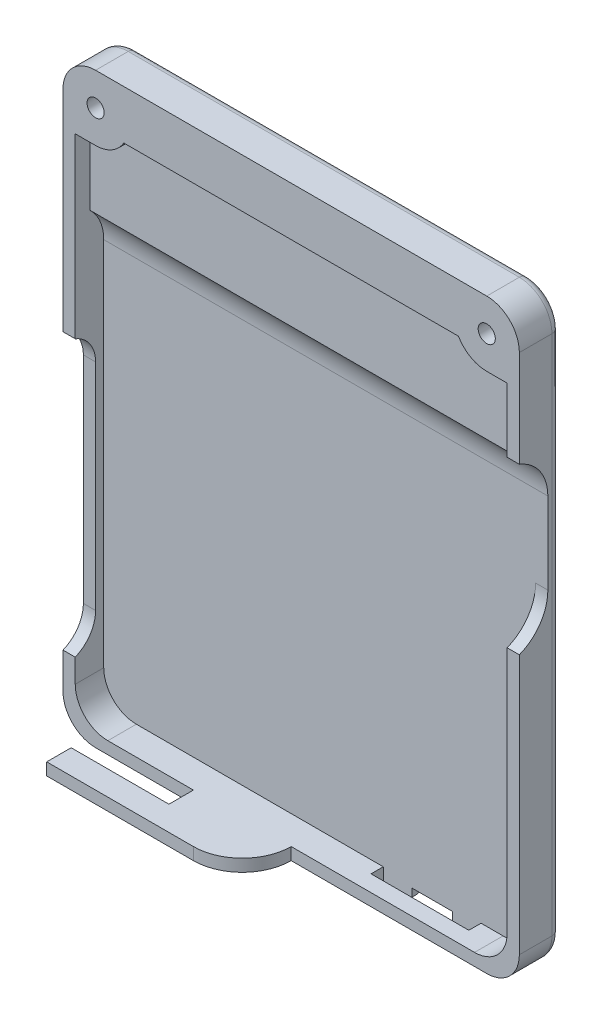
from build123d import *

# Parameters (mm, degrees)
SKETCH_1_W               = 56
SKETCH_1_H               = 72
EXTRUDE_1_DEPTH          = 5
SHELL_1_T                = -1.5
EXTRUDE_2_DEPTH          = 5
EXTRUDE_4_REACH          = 93.351
SKETCH_11_W              = 3.2
SKETCH_11_H              = 28
CUT_EXTRUDE_1_REACH      = 93.351
SKETCH_2_7_R             = 1.05
SKETCH_2_8_R             = 1.7
CUT_EXTRUDE_2_DEPTH      = 2.5
EXTRUDE_3_DEPTH          = 1.5
CUT_EXTRUDE_3_REACH      = 93.875
SKETCH_10_3_W            = 12
SKETCH_10_3_H            = 1.5
CUT_EXTRUDE_4_DEPTH      = 92.874914966
CUT_EXTRUDE_4_DEPTH_BACK = 1
SKETCH_10_4_W            = 5
SKETCH_10_4_H            = 1
CUT_EXTRUDE_5_REACH      = 93.875
CUT_EXTRUDE_START        = -54.5
CUT_EXTRUDE_6_DEPTH      = 54.5
FILLET_1_R               = 4
FILLET_2_R               = 4
FILLET_3_R               = 1


with BuildPart() as part:
    # 草图1 → 凸台-拉伸1 (new body)
    with BuildSketch(Plane.XY):
        with Locations((-28, 36)):
            Rectangle(SKETCH_1_W, SKETCH_1_H)
    extrude(amount=EXTRUDE_1_DEPTH)

    # 抽壳1
    shell_1_openings = [part.faces().sort_by_distance(p)[0] for p in [
        (-28, 36, 5),
    ]]
    offset(amount=SHELL_1_T, openings=shell_1_openings, kind=Kind.INTERSECTION)

    # 草图2 → 凸台-拉伸2 (add)
    with BuildSketch(Plane.XY):
        with BuildLine():
            Line((0, 72), (0, 68))
            ThreePointArc((0, 68), (-0.394448725, 66.267949192), (-1.5, 64.877501001))
            Line((-1.5, 64.877501001), (-1.5, 64))
            Line((-1.5, 64), (-4, 64))
            ThreePointArc((-4, 64), (-6, 64.535898385), (-7.464101615, 66))
            Line((-7.464101615, 66), (-48.535898385, 66))
            ThreePointArc((-48.535898385, 66), (-50, 64.535898385), (-52, 64))
            Line((-52, 64), (-54.5, 64))
            Line((-54.5, 64), (-54.5, 64.877501001))
            ThreePointArc((-54.5, 64.877501001), (-55.605551275, 66.267949192), (-56, 68))
            Line((-56, 68), (-56, 72))
            Line((-56, 72), (0, 72))
        make_face()
    extrude(amount=EXTRUDE_2_DEPTH)

    # 草图11 → 凸台-拉伸4 (add, up to next)
    with BuildSketch(Plane(origin=(0, 0, 0), x_dir=(0, 0, -1), z_dir=(1, 0, 0)), mode=Mode.PRIVATE) as extrude_4_sk1:
        with Locations((-1.6, 58)):
            Rectangle(SKETCH_11_W, SKETCH_11_H)
    extrude_4_tool1 = extrude(extrude_4_sk1.sketch, amount=-EXTRUDE_4_REACH, mode=Mode.PRIVATE) - part.part
    add(extrude_4_tool1.solids().sort_by_distance((0, 58, 1.6))[0])

    # 草图2<7> → 切除-拉伸1 (cut, up to next)
    with BuildSketch(Plane.XY, mode=Mode.PRIVATE) as cut_extrude_1_sk1:
        with Locations((-52, 68)):
            Circle(SKETCH_2_7_R)
    cut_extrude_1_tool1 = extrude(cut_extrude_1_sk1.sketch, amount=CUT_EXTRUDE_1_REACH, mode=Mode.PRIVATE) & part.part
    # 草图2<7> → 切除-拉伸1 (cut, up to next)
    with BuildSketch(Plane.XY, mode=Mode.PRIVATE) as cut_extrude_1_sk2:
        with Locations(Location((-4, 68, 0), (0, 0, 180))):
            Circle(SKETCH_2_7_R)
    cut_extrude_1_tool2 = extrude(cut_extrude_1_sk2.sketch, amount=CUT_EXTRUDE_1_REACH, mode=Mode.PRIVATE) & part.part
    add(cut_extrude_1_tool1.solids().sort_by_distance((-52, 68, 0))[0], mode=Mode.SUBTRACT)
    add(cut_extrude_1_tool2.solids().sort_by_distance((-4, 68, 0))[0], mode=Mode.SUBTRACT)

    # 草图2<8> → 切除-拉伸2 (cut)
    with BuildSketch(Plane.XY):
        with Locations((-52, 68)):
            Circle(SKETCH_2_8_R)
        with Locations(Location((-4, 68, 0), (0, 0, 180))):
            Circle(SKETCH_2_8_R)
    extrude(amount=CUT_EXTRUDE_2_DEPTH, mode=Mode.SUBTRACT)

    # 草图10 → 凸台-拉伸3 (add)
    with BuildSketch(Plane.XZ):
        with BuildLine():
            Line((-40, 5), (-40, 8))
            Line((-40, 8), (-52, 8))
            Line((-52, 8), (-52, 11))
            Line((-52, 11), (-34, 11))
            ThreePointArc((-34, 11), (-29.757359313, 9.242640687), (-28, 5))
            Line((-28, 5), (-40, 5))
        make_face()
    extrude(amount=-EXTRUDE_3_DEPTH)

    # 草图10<3> → 切除-拉伸3 (cut, up to next)
    with BuildSketch(Plane.XZ, mode=Mode.PRIVATE) as cut_extrude_3_sk1:
        with Locations((-14.2, 2.25)):
            Rectangle(SKETCH_10_3_W, SKETCH_10_3_H)
    cut_extrude_3_tool1 = extrude(cut_extrude_3_sk1.sketch, amount=-CUT_EXTRUDE_3_REACH, mode=Mode.PRIVATE) & part.part
    add(cut_extrude_3_tool1.solids().sort_by_distance((-14.2, 0, 2.25))[0], mode=Mode.SUBTRACT)

    # 草图10<4> → 切除-拉伸4 (cut, two sides: drawn at the far end of the back side and taken through both)
    with BuildSketch(Plane.XZ.offset(-CUT_EXTRUDE_4_DEPTH_BACK)):
        with Locations((-14.2, 1)):
            Rectangle(SKETCH_10_4_W, SKETCH_10_4_H)
    extrude(amount=CUT_EXTRUDE_4_DEPTH + CUT_EXTRUDE_4_DEPTH_BACK, mode=Mode.SUBTRACT)

    # 草图8 → 切除-拉伸5 (cut, up to next)
    with BuildSketch(Plane.ZY.offset(56), mode=Mode.PRIVATE) as cut_extrude_5_sk1:
        with BuildLine():
            Line((2.5, 38.500900756), (2.5, 12.087099244))
            ThreePointArc((2.5, 12.087099244), (3.18337521, 9.851031266), (5, 8.379))
            Line((5, 8.379), (5, 42.209))
            ThreePointArc((5, 42.209), (3.18337521, 40.736968734), (2.5, 38.500900756))
        make_face()
    cut_extrude_5_tool1 = extrude(cut_extrude_5_sk1.sketch, amount=-CUT_EXTRUDE_5_REACH, mode=Mode.PRIVATE) & part.part
    add(cut_extrude_5_tool1.solids().sort_by_distance((-56, 25.294, 3.786685))[0], mode=Mode.SUBTRACT)

    # 草图9 → 切除-拉伸6 (cut)
    with BuildSketch(Plane(origin=(0, 0, 0), x_dir=(0, 0, -1), z_dir=(1, 0, 0)).offset(CUT_EXTRUDE_START)):
        with BuildLine():
            Line((-1.5, 41), (-1.5, 51))
            ThreePointArc((-1.5, 51), (-7, 56.5), (-12.5, 51))
            Line((-12.5, 51), (-12.5, 41))
            ThreePointArc((-12.5, 41), (-7, 35.5), (-1.5, 41))
        make_face()
    extrude(amount=CUT_EXTRUDE_6_DEPTH, mode=Mode.SUBTRACT)

    # 圆角1
    fillet_1_edges = [part.edges().sort_by_distance(p)[0] for p in [
        (0, 0, 2.5),
        (-56, 0, 2.5),
        (-56, 72, 2.5),
        (0, 72, 2.5),
    ]]
    fillet(fillet_1_edges, radius=FILLET_1_R)

    # 圆角2
    fillet_2_edges = [part.edges().sort_by_distance(p)[0] for p in [
        (-1.5, 1.5, 3.25),
        (-54.5, 1.5, 3.25),
    ]]
    fillet(fillet_2_edges, radius=FILLET_2_R)

    # 圆角3
    # the kernel refuses this fillet: 1 mm, written as the material it takes off along each edge
    with BuildSketch(Plane(origin=(-52, 68, 0), x_dir=(1, 0, 0), z_dir=(0, -1, 0))) as fillet_3_piece_1:
        with BuildLine():
            CenterArc((1.7 + FILLET_3_R, FILLET_3_R), FILLET_3_R, 180, 90)
            Line((1.7, FILLET_3_R), (1.7, 0))
            Line((1.7, 0), (1.7 + FILLET_3_R, 0))
        make_face()
    revolve(axis=Axis((-52, 68, 0), (0, 0, 1)), mode=Mode.SUBTRACT)
    with BuildSketch(Plane(origin=(-4, 68, 0), x_dir=(-1, 0, 0), z_dir=(0, 1, 0))) as fillet_3_piece_2:
        with BuildLine():
            CenterArc((1.7 + FILLET_3_R, FILLET_3_R), FILLET_3_R, 180, 90)
            Line((1.7, FILLET_3_R), (1.7, 0))
            Line((1.7, 0), (1.7 + FILLET_3_R, 0))
        make_face()
    revolve(axis=Axis((-4, 68, 0), (0, 0, 1)), mode=Mode.SUBTRACT)
    with BuildSketch(Plane(origin=(-4, 4, 0), x_dir=(0, -1, 0), z_dir=(-1, 0, 0))) as fillet_3_piece_3:
        with BuildLine():
            CenterArc((4 - FILLET_3_R, FILLET_3_R), FILLET_3_R, 270, 90)
            Line((4 - FILLET_3_R, 0), (4, 0))
            Line((4, 0), (4, FILLET_3_R))
        make_face()
    revolve(axis=Axis((-4, 4, 0), (0, 0, 1)), revolution_arc=90, mode=Mode.SUBTRACT)
    with BuildSketch(Plane(origin=(0, 4, 0), x_dir=(0, 0, 1), z_dir=(0, 1, 0))) as fillet_3_piece_4:
        with BuildLine():
            CenterArc((FILLET_3_R, -FILLET_3_R), FILLET_3_R, 90, 90)
            Line((0, -FILLET_3_R), (0, 0))
            Line((0, 0), (FILLET_3_R, 0))
        make_face()
    extrude(amount=64, mode=Mode.SUBTRACT)
    with BuildSketch(Plane(origin=(-4, 68, 0), x_dir=(0, 1, 0), z_dir=(-1, 0, 0))) as fillet_3_piece_5:
        with BuildLine():
            CenterArc((4 - FILLET_3_R, -FILLET_3_R), FILLET_3_R, 0, 90)
            Line((4, -FILLET_3_R), (4, 0))
            Line((4, 0), (4 - FILLET_3_R, 0))
        make_face()
    revolve(axis=Axis((-4, 68, 0), (0, 0, -1)), revolution_arc=90, mode=Mode.SUBTRACT)
    with BuildSketch(Plane(origin=(-52, 72, 0), x_dir=(0, -1, 0), z_dir=(1, 0, 0))) as fillet_3_piece_6:
        with BuildLine():
            CenterArc((FILLET_3_R, -FILLET_3_R), FILLET_3_R, 90, 90)
            Line((0, -FILLET_3_R), (0, 0))
            Line((0, 0), (FILLET_3_R, 0))
        make_face()
    extrude(amount=48, mode=Mode.SUBTRACT)
    with BuildSketch(Plane(origin=(-52, 68, 0), x_dir=(0, 1, 0), z_dir=(1, 0, 0))) as fillet_3_piece_7:
        with BuildLine():
            CenterArc((4 - FILLET_3_R, FILLET_3_R), FILLET_3_R, 270, 90)
            Line((4, FILLET_3_R), (4, 0))
            Line((4, 0), (4 - FILLET_3_R, 0))
        make_face()
    revolve(axis=Axis((-52, 68, 0), (0, 0, 1)), revolution_arc=90, mode=Mode.SUBTRACT)
    with BuildSketch(Plane(origin=(-56, 68, 0), x_dir=(1, 0, 0), z_dir=(0, -1, 0))) as fillet_3_piece_8:
        with BuildLine():
            CenterArc((FILLET_3_R, FILLET_3_R), FILLET_3_R, 180, 90)
            Line((0, FILLET_3_R), (0, 0))
            Line((0, 0), (FILLET_3_R, 0))
        make_face()
    extrude(amount=64, mode=Mode.SUBTRACT)
    with BuildSketch(Plane(origin=(-52, 4, 0), x_dir=(0, -1, 0), z_dir=(1, 0, 0))) as fillet_3_piece_9:
        with BuildLine():
            CenterArc((4 - FILLET_3_R, -FILLET_3_R), FILLET_3_R, 0, 90)
            Line((4, -FILLET_3_R), (4, 0))
            Line((4, 0), (4 - FILLET_3_R, 0))
        make_face()
    revolve(axis=Axis((-52, 4, 0), (0, 0, -1)), revolution_arc=90, mode=Mode.SUBTRACT)
    with BuildSketch(Plane(origin=(-4, 0, 0), x_dir=(0, 0, 1), z_dir=(-1, 0, 0))) as fillet_3_piece_10:
        with BuildLine():
            CenterArc((FILLET_3_R, FILLET_3_R), FILLET_3_R, 180, 90)
            Line((0, FILLET_3_R), (0, 0))
            Line((0, 0), (FILLET_3_R, 0))
        make_face()
    extrude(amount=48, mode=Mode.SUBTRACT)


solid = part.part
